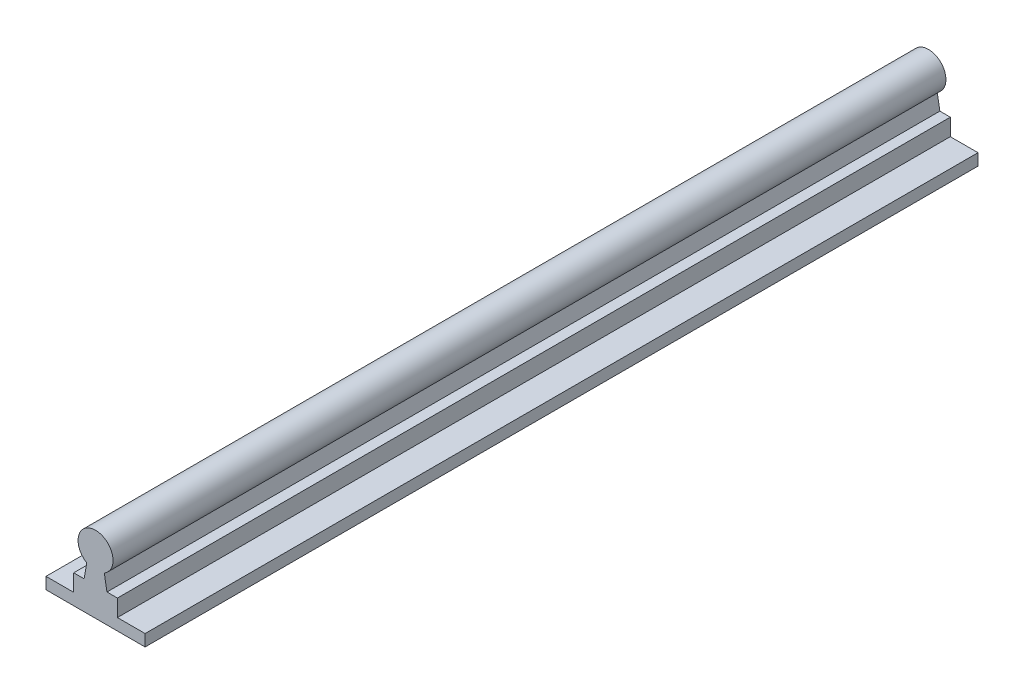
from build123d import *

# Parameters (mm, degrees)
BOSS_EXTRUDE1_DEPTH = 285.75


with BuildPart() as part:
    # Sketch1 → Boss-Extrude1 (new body)
    with BuildSketch(Plane.XY):
        with BuildLine():
            Line((21.307457755, 0), (-12.692542245, 0))
            Line((-12.692542245, 0), (-12.692542245, 4))
            Line((-12.692542245, 4), (-3.192542245, 4))
            Line((-3.192542245, 4), (-3.192542245, 9.8))
            Line((-3.192542245, 9.8), (0.390557455, 9.8))
            Line((0.390557455, 9.8), (1.307457755, 15))
            ThreePointArc((1.307457755, 15), (4.307457755, 26.196152423), (7.307457755, 15))
            Line((7.307457755, 15), (8.224358055, 9.8))
            Line((8.224358055, 9.8), (11.807457755, 9.8))
            Line((11.807457755, 9.8), (11.807457755, 4))
            Line((11.807457755, 4), (21.307457755, 4))
            Line((21.307457755, 4), (21.307457755, 0))
        make_face()
    extrude(amount=BOSS_EXTRUDE1_DEPTH)


solid = part.part
